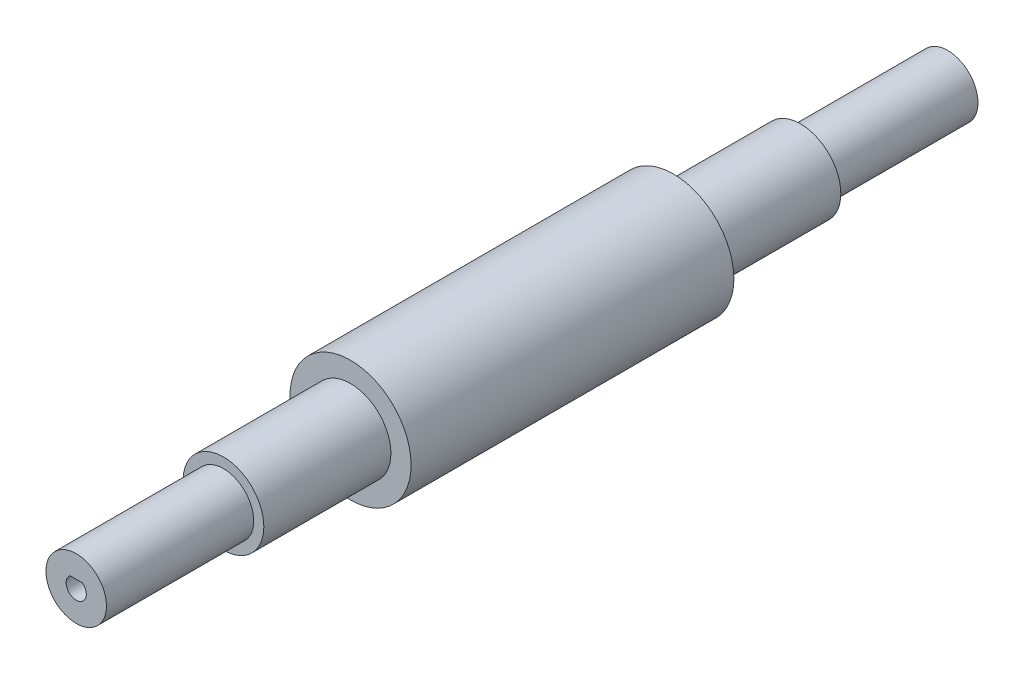
from build123d import *

# Parameters (mm, degrees)
ESQUISSE1_R        = 15
BOSS_EXTRU_1_DEPTH = 40
BOSS_EXTRU_5_START = 40
ESQUISSE1_10_R     = 10
BOSS_EXTRU_5_DEPTH = 31.5
BOSS_EXTRU_3_START = 71.5
ESQUISSE1_7_R      = 7.5
BOSS_EXTRU_3_DEPTH = 36.5
BOSS_EXTRU_4_START = -71.5
ESQUISSE1_8_R      = 7.5
BOSS_EXTRU_4_DEPTH = 36.5
BOSS_EXTRU_6_START = -71.5
ESQUISSE1_11_R     = 10
BOSS_EXTRU_6_DEPTH = 31.5


with BuildPart() as part:
    # Esquisse1 → Boss.-Extru.1 (new, symmetric)
    with BuildSketch(Plane.XY):
        Circle(ESQUISSE1_R)
    extrude(amount=BOSS_EXTRU_1_DEPTH, both=True)

    # Esquisse1<10> → Boss.-Extru.5 (add)
    with BuildSketch(Plane.XY.offset(BOSS_EXTRU_5_START)):
        Circle(ESQUISSE1_10_R)
    extrude(amount=BOSS_EXTRU_5_DEPTH)



with BuildPart() as body_2:
    # Esquisse1<7> → Boss.-Extru.3 (new body)
    with BuildSketch(Plane.XY.offset(BOSS_EXTRU_3_START)):
        Circle(ESQUISSE1_7_R)
        with BuildLine():
            Line((-1.5, 2), (1.5, 2))
            ThreePointArc((1.5, 2), (0, -2.5), (-1.5, 2))
        make_face(mode=Mode.SUBTRACT)
    extrude(amount=BOSS_EXTRU_3_DEPTH)


with BuildPart() as body_3:
    # Esquisse1<8> → Boss.-Extru.4 (new body)
    with BuildSketch(Plane.XY.offset(BOSS_EXTRU_4_START)):
        Circle(ESQUISSE1_8_R)
        with BuildLine():
            Line((-1.5, 2), (1.5, 2))
            ThreePointArc((1.5, 2), (0, -2.5), (-1.5, 2))
        make_face(mode=Mode.SUBTRACT)
    extrude(amount=-BOSS_EXTRU_4_DEPTH)


with BuildPart() as part_1:
    add(part.part)

    add(body_3.part)  # Boss.-Extru.6 merges body 3
    # Esquisse1<11> → Boss.-Extru.6 (add)
    with BuildSketch(Plane.XY.offset(BOSS_EXTRU_6_START)):
        Circle(ESQUISSE1_11_R)
    extrude(amount=BOSS_EXTRU_6_DEPTH)


solid = Compound([body_2.part, part_1.part])
